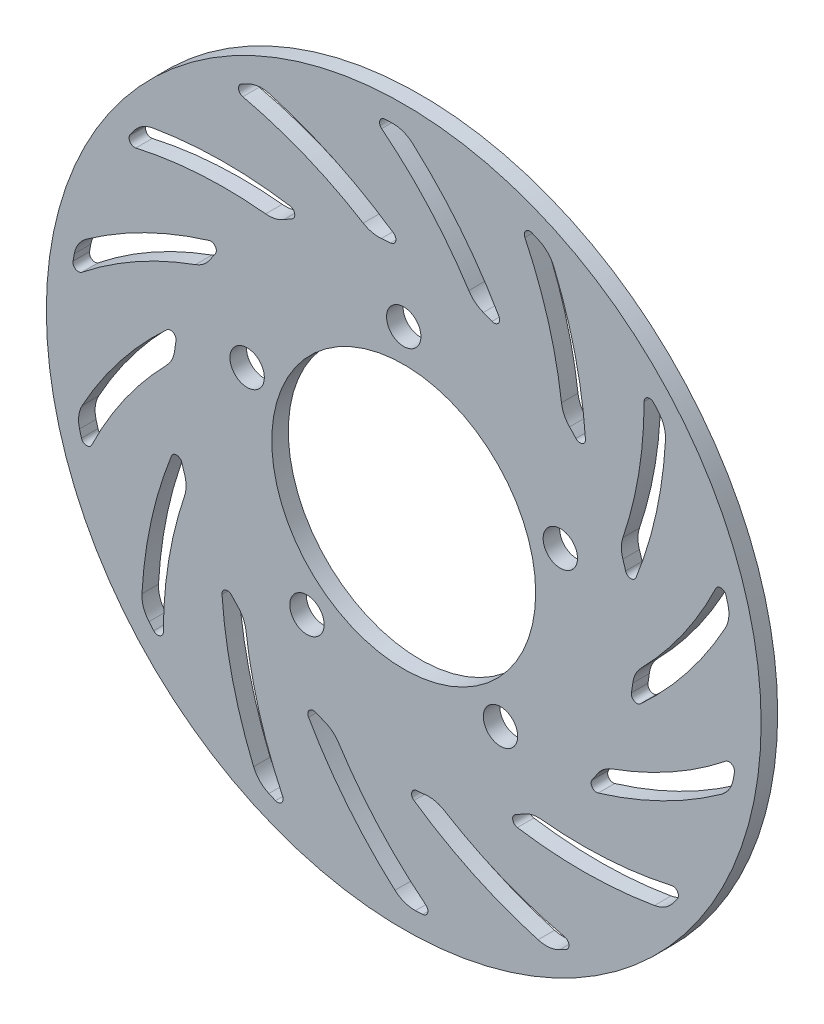
from build123d import *

# Parameters (mm, degrees)
SKETCH1_R                = 103.1875
BASE_FLANGE1_DEPTH       = 4.7752
SKETCH6_R                = 4.9609375
CUT_EXTRUDE1_DEPTH       = 147.007269845
SKETCH7_R                = 38.1
CUT_EXTRUDE2_DEPTH       = 147.007269845
CUT_EXTRUDE6_DEPTH       = 147.007269845
FILLET2_R                = 1.5875
FILLET3_R                = 8.466666667
CIRPATTERN3_COUNT        = 14
FILLET2_OF_CIRPATTERN3_R = 1.5875
FILLET3_OF_CIRPATTERN3_R = 8.466666667


# Sheet-metal steps are written as plain solids
with BuildPart() as part:
    # Sketch1 → Base-Flange1 (new body)
    with BuildSketch(Plane.XY):
        Circle(SKETCH1_R)
    extrude(amount=-BASE_FLANGE1_DEPTH)

    # Sketch6 → Cut-Extrude1 (cut, through all)
    with BuildSketch(Plane.XY):
        with Locations((0, 47.534367171)):
            Circle(SKETCH6_R)
        with Locations((45.207869646, 14.688927273)):
            Circle(SKETCH6_R)
        with Locations((27.94, -38.456110858)):
            Circle(SKETCH6_R)
        with Locations((-27.94, -38.456110858)):
            Circle(SKETCH6_R)
        with Locations((-45.207869646, 14.688927273)):
            Circle(SKETCH6_R)
    extrude(amount=-CUT_EXTRUDE1_DEPTH, mode=Mode.SUBTRACT)

    # Sketch7 → Cut-Extrude2 (cut, through all)
    with BuildSketch(Plane.XY):
        Circle(SKETCH7_R)
    extrude(amount=-CUT_EXTRUDE2_DEPTH, mode=Mode.SUBTRACT)

    # Sketch14 → Cut-Extrude6 (cut, through all)
    with BuildSketch(Plane.XY):
        with BuildLine():
            ThreePointArc((0, 96.8375), (16.707624198, 79.710005113), (29.767032143, 59.661372951))
            ThreePointArc((29.767032143, 59.661372951), (25.116422432, 61.763427279), (20.318653947, 63.50360562))
            ThreePointArc((20.318653947, 63.50360562), (6.935369559, 81.376622779), (-9.620686715, 96.358413195))
            ThreePointArc((-9.620686715, 96.358413195), (-4.816304004, 96.717654138), (0, 96.8375))
        make_face()
    cut_extrude6 = extrude(amount=-CUT_EXTRUDE6_DEPTH, mode=Mode.SUBTRACT)

    # Fillet2
    fillet2_edges = [part.edges().sort_by_distance(p)[0] for p in [
        (-9.620686715, 96.358413195, -2.3876),
        (29.767032143, 59.661372951, -2.3876),
    ]]
    fillet(fillet2_edges, radius=FILLET2_R)

    # Fillet3
    fillet3_edges = [part.edges().sort_by_distance(p)[0] for p in [
        (0, 96.8375, -2.3876),
        (20.318653947, 63.50360562, -2.3876),
    ]]
    fillet(fillet3_edges, radius=FILLET3_R)

    # CirPattern3: Cut-Extrude6 ×14 about axis
    cirpattern3_axis = Axis((0, 0, 0), (0, 0, 1))
    for i in range(1, CIRPATTERN3_COUNT):
        add(cut_extrude6.rotate(cirpattern3_axis, i * 360 / CIRPATTERN3_COUNT), mode=Mode.SUBTRACT)

    # Fillet2 of CirPattern3
    fillet2_of_cirpattern3_edges = [part.edges().sort_by_distance(p)[0] for p in [
        (-50.47628783, 82.641670924, -2.3876),
        (0.933069674, 66.668470854, -2.3876),
        (-81.33444109, 52.556732194, -2.3876),
        (-28.085698687, 60.471060469, -2.3876),
        (-96.08331079, 12.062288086, -2.3876),
        (-51.541749975, 42.296614929, -2.3876),
        (-91.801702404, -30.821240111, -2.3876),
        (-64.789325562, 15.744806069, -2.3876),
        (-69.337640983, -67.600243707, -2.3876),
        (-65.204580633, -13.92545473, -2.3876),
        (-33.140409395, -90.990189973, -2.3876),
        (-52.705268828, -40.837608436, -2.3876),
        (9.620686715, -96.358413195, -2.3876),
        (-29.767032143, -59.661372951, -2.3876),
        (50.47628783, -82.641670924, -2.3876),
        (-0.933069674, -66.668470854, -2.3876),
        (81.33444109, -52.556732194, -2.3876),
        (28.085698687, -60.471060469, -2.3876),
        (96.08331079, -12.062288086, -2.3876),
        (51.541749975, -42.296614929, -2.3876),
        (91.801702404, 30.821240111, -2.3876),
        (64.789325562, -15.744806069, -2.3876),
        (69.337640983, 67.600243707, -2.3876),
        (65.204580633, 13.92545473, -2.3876),
        (33.140409395, 90.990189973, -2.3876),
        (52.705268828, 40.837608436, -2.3876),
    ]]
    fillet(fillet2_of_cirpattern3_edges, radius=FILLET2_OF_CIRPATTERN3_R)

    # Fillet3 of CirPattern3
    fillet3_of_cirpattern3_edges = [part.edges().sort_by_distance(p)[0] for p in [
        (-42.016216587, 87.247572746, -2.3876),
        (-9.24670721, 66.030705212, -2.3876),
        (-75.710606183, 60.377193687, -2.3876),
        (-36.980644601, 55.479613823, -2.3876),
        (-94.409581696, 21.548370942, -2.3876),
        (-57.39011179, 33.940104503, -2.3876),
        (-94.409581696, -21.548370942, -2.3876),
        (-66.432763496, 5.678341239, -2.3876),
        (-75.710606183, -60.377193687, -2.3876),
        (-62.317591648, -23.708087148, -2.3876),
        (-42.016216587, -87.247572746, -2.3876),
        (-45.859656498, -48.398838115, -2.3876),
        (0, -96.8375, -2.3876),
        (-20.318653947, -63.50360562, -2.3876),
        (42.016216587, -87.247572746, -2.3876),
        (9.24670721, -66.030705212, -2.3876),
        (75.710606183, -60.377193687, -2.3876),
        (36.980644601, -55.479613823, -2.3876),
        (94.409581696, -21.548370942, -2.3876),
        (57.39011179, -33.940104503, -2.3876),
        (94.409581696, 21.548370942, -2.3876),
        (66.432763496, -5.678341239, -2.3876),
        (75.710606183, 60.377193687, -2.3876),
        (62.317591648, 23.708087148, -2.3876),
        (42.016216587, 87.247572746, -2.3876),
        (45.859656498, 48.398838115, -2.3876),
    ]]
    fillet(fillet3_of_cirpattern3_edges, radius=FILLET3_OF_CIRPATTERN3_R)


solid = part.part
